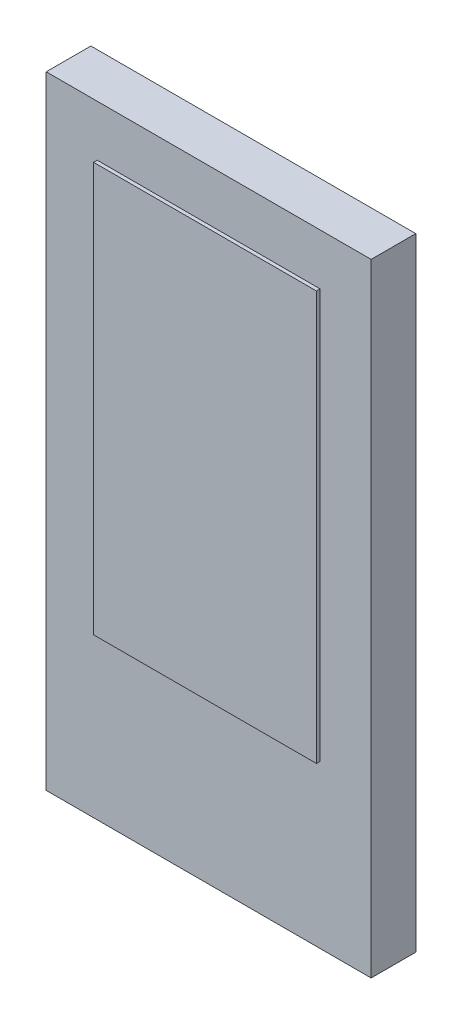
from build123d import *

# Parameters (mm, degrees)
ESQUISSE1_W        = 8.928
ESQUISSE1_H        = 17.1
BOSS_EXTRU_1_DEPTH = 1.227
ESQUISSE2_W        = 6.124
ESQUISSE2_H        = 11.244
BOSS_EXTRU_2_DEPTH = 0.1


with BuildPart() as part:
    # Esquisse1 → Boss.-Extru.1 (new body)
    with BuildSketch(Plane.XY):
        Rectangle(ESQUISSE1_W, ESQUISSE1_H)
    extrude(amount=BOSS_EXTRU_1_DEPTH)

    # Esquisse2 → Boss.-Extru.2 (add)
    with BuildSketch(Plane.XY.offset(1.227)):
        with Locations((0, 1.525)):
            Rectangle(ESQUISSE2_W, ESQUISSE2_H)
    extrude(amount=BOSS_EXTRU_2_DEPTH)


solid = part.part
